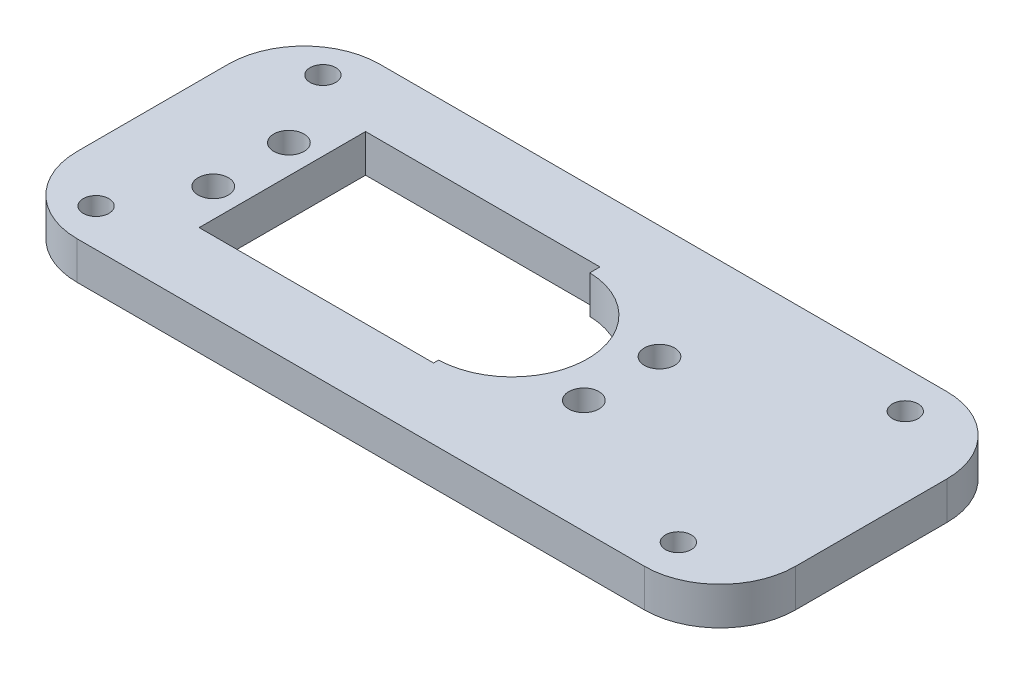
from build123d import *

# Parameters (mm, degrees)
SKETCH9_W           = 95
SKETCH9_H           = 40
BOSS_EXTRUDE5_DEPTH = 5
SKETCH10_R          = 2
CUT_EXTRUDE5_DEPTH  = 52.780787943
SKETCH11_R          = 1.7
CUT_EXTRUDE6_DEPTH  = 52.780787943
FILLET1_R           = 10


with BuildPart() as part:
    # Sketch9 → Boss-Extrude5 (new body)
    with BuildSketch(Plane(origin=(0, 0, 0), x_dir=(1, 0, 0), z_dir=(0, 1, 0))):
        Rectangle(SKETCH9_W, SKETCH9_H)
    extrude(amount=BOSS_EXTRUDE5_DEPTH)

    # Sketch10 → Cut-Extrude5 (cut, through all)
    with BuildSketch(Plane(origin=(0, 5, 0), x_dir=(1, 0, 0), z_dir=(0, 1, 0))):
        with BuildLine():
            Line((0.292318991, 11.338961004), (-30.707681009, 11.345685511))
            Line((-30.707681009, 11.345685511), (-30.711010445, -10.656347446))
            Line((-30.711010445, -10.656347446), (0.292318991, -10.661038996))
            Line((0.292318991, -10.661038996), (0.292318991, -9.995726567))
            ThreePointArc((0.292318991, -9.995726567), (10, 0), (0.292318991, 9.995726567))
            Line((0.292318991, 9.995726567), (0.292318991, 11.338961004))
        make_face()
        with Locations((14.5, 5)):
            Circle(SKETCH10_R)
        with Locations((14.5, -5)):
            Circle(SKETCH10_R)
        with Locations((-34.5, 5)):
            Circle(SKETCH10_R)
        with Locations((-34.5, -5)):
            Circle(SKETCH10_R)
    extrude(amount=-CUT_EXTRUDE5_DEPTH, mode=Mode.SUBTRACT)

    # Sketch11 → Cut-Extrude6 (cut, through all)
    with BuildSketch(Plane(origin=(0, 5, 0), x_dir=(1, 0, 0), z_dir=(0, 1, 0))):
        with Locations((-40, 15)):
            Circle(SKETCH11_R)
        with Locations((37, 15)):
            Circle(SKETCH11_R)
        with Locations((37, -15)):
            Circle(SKETCH11_R)
        with Locations((-40, -15)):
            Circle(SKETCH11_R)
    extrude(amount=-CUT_EXTRUDE6_DEPTH, mode=Mode.SUBTRACT)

    # Fillet1
    fillet1_edges = [part.edges().sort_by_distance(p)[0] for p in [
        (47.5, 2.5, 20),
        (-47.5, 2.5, 20),
        (-47.5, 2.5, -20),
        (47.5, 2.5, -20),
    ]]
    fillet(fillet1_edges, radius=FILLET1_R)


solid = part.part
